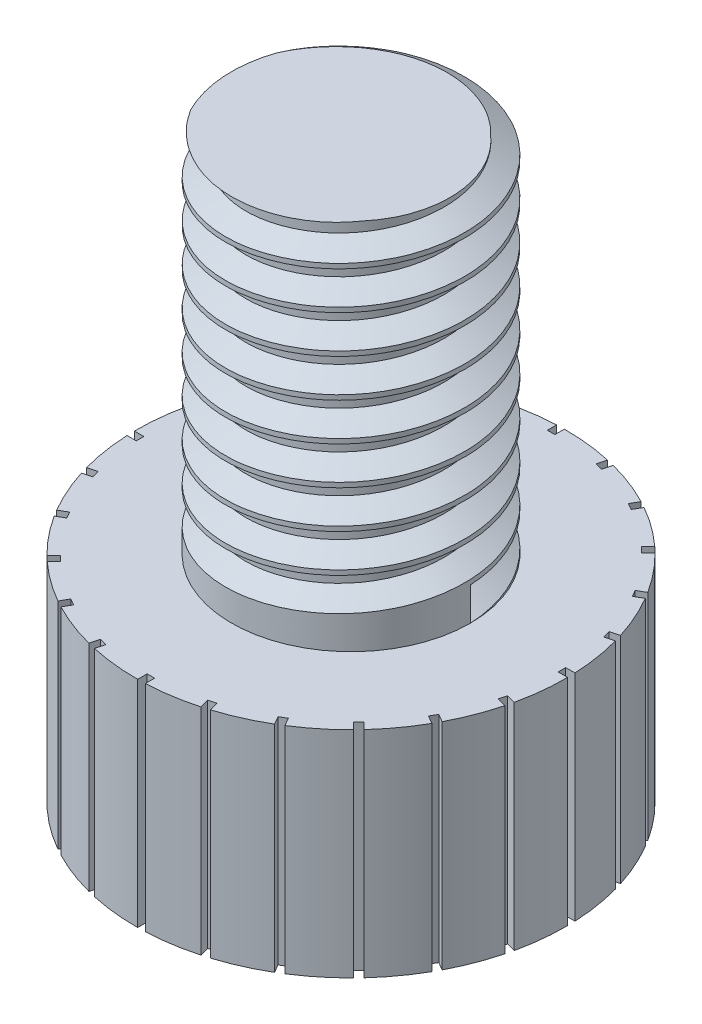
from build123d import *
from build123d.topology import SkipClean

# Parameters (mm, degrees)
SKETCH_1_R               = 1.8
EXTRUDE_1_DEPTH          = 1.8
SKETCH_2_R               = 1
EXTRUDE_2_DEPTH          = 3
THREAD_1_PITCH           = 0.3175
CUT_EXTRUDE_1_DEPTH      = 1
SKETCH_8_W               = 0.063017892
SKETCH_8_H               = 0.222036209
CUT_EXTRUDE_2_DEPTH      = 2
PATTERN_CIRCULAR_2_COUNT = 24


with BuildPart() as part:
    # 草图1 → 凸台-拉伸1 (new body)
    with BuildSketch(Plane(origin=(0, 0, 0), x_dir=(1, 0, 0), z_dir=(0, 1, 0))):
        with Locations(Location((0, 0, 0), (0, 0, 270))):
            Circle(SKETCH_1_R)
    extrude(amount=EXTRUDE_1_DEPTH)

    # Sketch 2 → 凸台-拉伸2 (add)
    with BuildSketch(Plane(origin=(0, 1.8, 0), x_dir=(1, 0, 0), z_dir=(0, 1, 0))):
        with Locations(Location((0, 0, 0), (0, 0, 270))):
            Circle(SKETCH_2_R)
    extrude(amount=EXTRUDE_2_DEPTH)

    # 螺纹线1: the profile of Sketch 2 2 profile screwed along a right-hand helix of 18.897638 turns, 6 arcs to a turn; built about Z, then put on its axis
    with SkipClean():  # the faces are left unmerged after this step: merging them gives an invalid solid
        thread_1_z = Axis((0, 0, 0), (0, 0, 1))
        thread_1_corners = [(1.0003, 0, -0.000173205), (1.0003, 0, 0.277985704), (0.828148085, 0, 0.17859375), (0.828148085, 0, 0.09921875)]
        with BuildLine(mode=Mode.PRIVATE) as thread_1_profile:
            Line(thread_1_corners[0], thread_1_corners[1])
            Line(thread_1_corners[1], thread_1_corners[2])
            Line(thread_1_corners[2], thread_1_corners[3])
            Line(thread_1_corners[3], thread_1_corners[0])
        thread_1_cap = Face(thread_1_profile.wire())
        thread_1_turn_angles = [0, 30, 60, 90, 120, 150, 180, 210, 240, 270, 300, 330, 360]
        thread_1_turn_weights = [1, 0.8660254037844387, 1, 0.8660254037844387, 1, 0.8660254037844387, 1, 0.8660254037844387, 1, 0.8660254037844387, 1, 0.8660254037844387, 1]
        thread_1_turn_rails = [Edge.make_bspline([Vector(p[0], p[1], 0).rotate(thread_1_z, thread_1_turn_angles[k]) / thread_1_turn_weights[k] + Vector(0, 0, p[2] + THREAD_1_PITCH * thread_1_turn_angles[k] / 360) for k in range(13)], [0, 0, 0, 1, 1, 2, 2, 3, 3, 4, 4, 5, 5, 6, 6, 6], 2, thread_1_turn_weights) for p in thread_1_corners]
        thread_1_turn_sides = [Face.make_surface_from_curves(thread_1_turn_rails[p[0]], thread_1_turn_rails[p[1]]) for p in [(0, 1), (1, 2), (2, 3), (3, 0)]]
        thread_1_last_angles = [6480, 6510, 6540, 6570, 6600, 6630, 6660, 6690, 6720, 6750, 6780, 6791.57480315, 6803.149606299]
        thread_1_last_weights = [1, 0.8660254037844387, 1, 0.8660254037844387, 1, 0.8660254037844387, 1, 0.8660254037844387, 1, 0.8660254037844387, 1, 0.9796635825089068, 1]
        thread_1_last_rails = [Edge.make_bspline([Vector(p[0], p[1], 0).rotate(thread_1_z, thread_1_last_angles[k]) / thread_1_last_weights[k] + Vector(0, 0, p[2] + THREAD_1_PITCH * thread_1_last_angles[k] / 360) for k in range(13)], [0, 0, 0, 1, 1, 2, 2, 3, 3, 4, 4, 5, 5, 6, 6, 6], 2, thread_1_last_weights) for p in thread_1_corners]
        thread_1_last_sides = [Face.make_surface_from_curves(thread_1_last_rails[p[0]], thread_1_last_rails[p[1]]) for p in [(0, 1), (1, 2), (2, 3), (3, 0)]]
        thread_1 = Plane(origin=(0, 1.8, 0), x_dir=(1, 0, 0), z_dir=(0, 1, 0)) * Solid(Shell([*[p.moved(Location((0, 0, THREAD_1_PITCH * i))) for i in range(18) for p in thread_1_turn_sides], *thread_1_last_sides, thread_1_cap, thread_1_cap.rotate(thread_1_z, 6803.149606299).moved(Location((0, 0, THREAD_1_PITCH * 6803.149606299 / 360)))]))
        add(thread_1, mode=Mode.SUBTRACT)

    # 草图7 → 切除-拉伸1 (cut)
    with SkipClean():  # the faces are left unmerged after this step: merging them gives an invalid solid
        with BuildSketch(Plane(origin=(0, 0, 0), x_dir=(-1, 0, 0), z_dir=(0, -1, 0))):
            Polygon((-0.866025404, 0), (-0.433012702, -0.75), (0.433012702, -0.75), (0.866025404, 0), (0.433012702, 0.75), (-0.433012702, 0.75), align=None)
        extrude(amount=-CUT_EXTRUDE_1_DEPTH, mode=Mode.SUBTRACT)

    # 草图8 → 切除-拉伸2 (cut)
    with SkipClean():  # the faces are left unmerged after this step: merging them gives an invalid solid
        with BuildSketch(Plane(origin=(0, 0, 0), x_dir=(-1, 0, 0), z_dir=(0, -1, 0))):
            with Locations((0.045326247, 1.83180046)):
                Rectangle(SKETCH_8_W, SKETCH_8_H)
        cut_extrude_2 = extrude(amount=-CUT_EXTRUDE_2_DEPTH, mode=Mode.SUBTRACT)

    # 阵列(圆周)2: 切除-拉伸2 ×24 about axis
    with SkipClean():  # the faces are left unmerged after this step: merging them gives an invalid solid
        pattern_circular_2_axis = Axis((0, 0, 0), (0, 1, 0))
        for i in range(1, PATTERN_CIRCULAR_2_COUNT):
            add(cut_extrude_2.rotate(pattern_circular_2_axis, i * 360 / PATTERN_CIRCULAR_2_COUNT), mode=Mode.SUBTRACT)


solid = part.part
